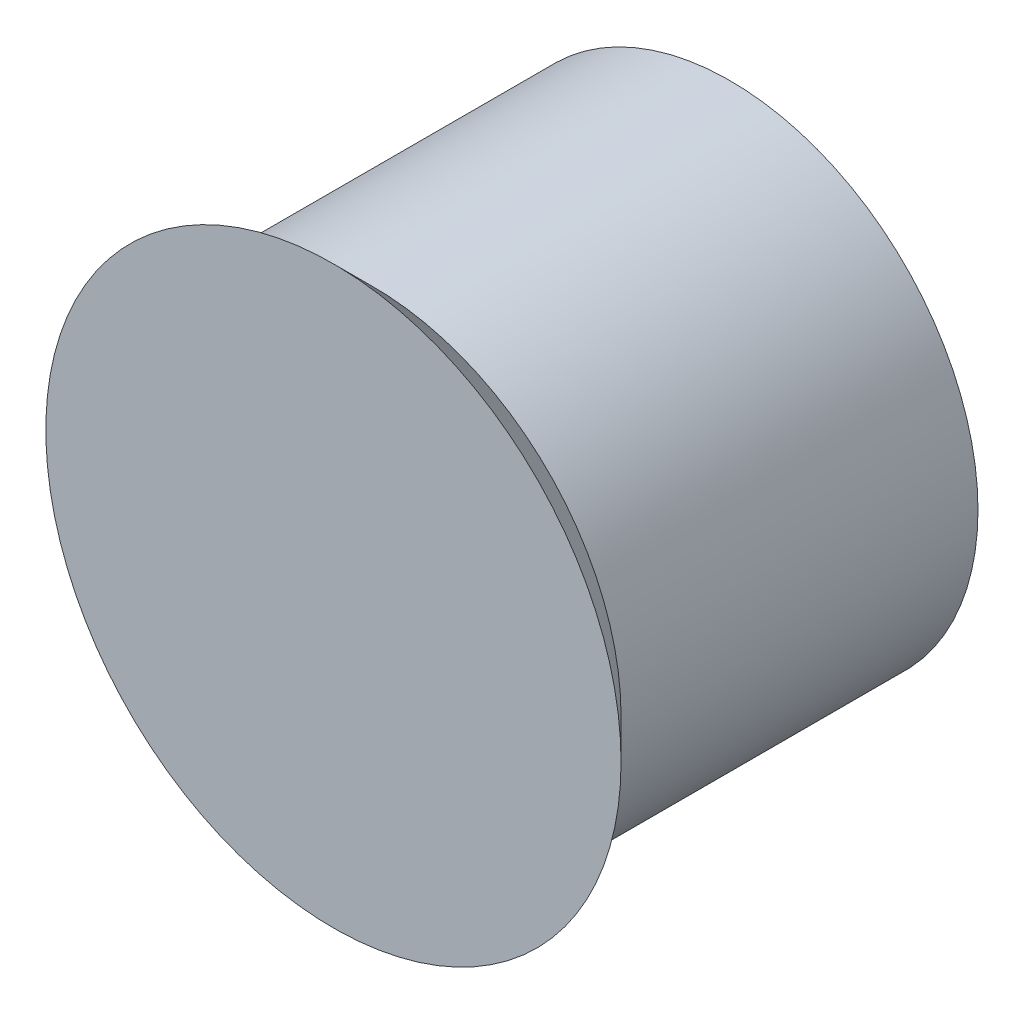
from build123d import *

# Parameters (mm, degrees)
IZIM1_R                     = 1.25
Y_KSEKLIK_EKSTR_ZYON1_DEPTH = 1.8
IZIM2_R                     = 1.250235766
Y_KSEKLIK_EKSTR_ZYON2_DEPTH = 0.2
Y_KSEKLIK_EKSTR_ZYON2_DRAFT = -45


with BuildPart() as part:
    # Çizim1 → Yükseklik-Ekstrüzyon1 (new body)
    with BuildSketch(Plane.XY):
        Circle(IZIM1_R)
    extrude(amount=Y_KSEKLIK_EKSTR_ZYON1_DEPTH)


with BuildPart() as y_kseklik_ekstr_zyon2_tool:
    # Çizim2 → Yükseklik-Ekstrüzyon2 (with draft: the straight prism first)
    with BuildSketch(Plane.XY.offset(1.8)):
        Circle(IZIM2_R)
    extrude(amount=Y_KSEKLIK_EKSTR_ZYON2_DEPTH)
    # Yükseklik-Ekstrüzyon2: the draft: its side faces are tilted about the plane it starts from
    y_kseklik_ekstr_zyon2_sides = [y_kseklik_ekstr_zyon2_tool.faces().sort_by_distance(p)[0] for p in [
        (-1.250235766, 0, 1.9),
    ]]
    draft(y_kseklik_ekstr_zyon2_sides, Plane.XY.offset(1.8), Y_KSEKLIK_EKSTR_ZYON2_DRAFT)


with BuildPart() as part_1:
    add(part.part)

    # Yükseklik-Ekstrüzyon2: add y_kseklik_ekstr_zyon2_tool
    add(y_kseklik_ekstr_zyon2_tool.part)


solid = part_1.part
